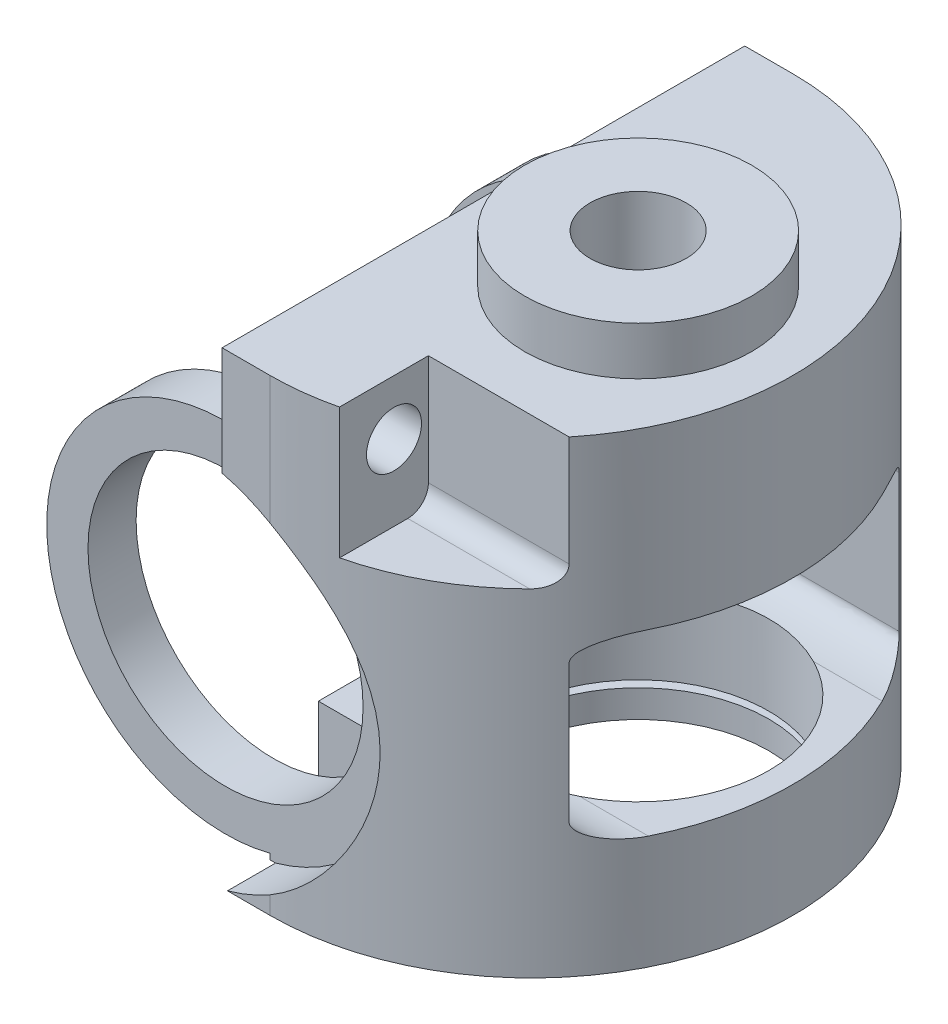
from build123d import *

# Parameters (mm, degrees)
SKETCH2_R               = 3.5
BOSS_EXTRUDE1_DEPTH     = 34
SKETCH19_R              = 8.25
SKETCH19_R_2            = 3.5
BOSS_EXTRUDE3_DEPTH     = 3.5
SKETCH7_R               = 13.5
CUT_EXTRUDE4_DEPTH      = 3.5
SKETCH25_R              = 13
BOSS_EXTRUDE4_DEPTH     = 3.5
SKETCH27_R              = 10
CUT_EXTRUDE13_DEPTH     = 3.5
LPATTERN3_COUNT         = 2
LPATTERN3_PITCH         = 34.5
LPATTERN4_COUNT         = 2
LPATTERN4_PITCH         = 27.5
SKETCH6_W               = 24
SKETCH6_H               = 13
CUT_EXTRUDE3_DEPTH      = 48.681233293
FILLET2_SIZE            = 3.5
FILLET2_SIZE_2          = 1.5
FILLET3_SIZE            = 1.5
FILLET3_SIZE_2          = 3.5
M2_TAPPED_HOLE1_D       = 1.6
M2_TAPPED_HOLE1_DEPTH   = 5.5
M2_TAPPED_HOLE1_TIP     = 0.480688495
SKETCH17_R              = 2
CUT_EXTRUDE5_DEPTH      = 8
CUT_EXTRUDE6_REACH      = 50.532
CUT_EXTRUDE6_END_RADIUS = 19
SKETCH20_R              = 9.75
CUT_EXTRUDE7_DEPTH      = 6.25
SKETCH21_R              = 8.5
CUT_EXTRUDE8_DEPTH      = 0.5
CUT_EXTRUDE9_DEPTH      = 1
CUT_EXTRUDE9_DEPTH_BACK = 5.75
SKETCH22_R              = 9.5
SKETCH23_R              = 10.5
CUT_EXTRUDE10_DEPTH     = 0.5
SKETCH24_R              = 9.5
CUT_EXTRUDE11_DEPTH     = 2


with BuildPart() as part:
    # Sketch2 → Boss-Extrude1 (new body)
    with BuildSketch(Plane(origin=(0, 0, 0), x_dir=(1, 0, 0), z_dir=(0, 1, 0))):
        with BuildLine():
            Line((-3.5, -19), (-3.5, 19))
            Line((-3.5, 19), (0, 19))
            ThreePointArc((0, 19), (19, 0), (0, -19))
            Line((0, -19), (-3.5, -19))
        make_face()
        with Locations(Location((7.75, 0, 0), (0, 0, 270))):
            Circle(SKETCH2_R, mode=Mode.SUBTRACT)
    extrude(amount=BOSS_EXTRUDE1_DEPTH)

    # Sketch19 → Boss-Extrude3 (add)
    with BuildSketch(Plane(origin=(0, 34, 0), x_dir=(1, 0, 0), z_dir=(0, 1, 0))):
        with Locations(Location((7.75, 0, 0), (0, 0, 270))):
            Circle(SKETCH19_R)
        with Locations(Location((7.75, 0, 0), (0, 0, 270))):
            Circle(SKETCH19_R_2, mode=Mode.SUBTRACT)
    extrude(amount=BOSS_EXTRUDE3_DEPTH)

    # Sketch7 → Cut-Extrude4 (cut)
    with BuildSketch(Plane(origin=(0, 0, 19), x_dir=(-1, 0, 0), z_dir=(0, 0, -1))):
        with Locations((6.75, 13)):
            Circle(SKETCH7_R)
    cut_extrude4 = extrude(amount=CUT_EXTRUDE4_DEPTH, mode=Mode.SUBTRACT)

    # Sketch25 → Boss-Extrude4 (add)
    with BuildSketch(Plane.XY.offset(15.5)):
        with Locations((-6.75, 13)):
            Circle(SKETCH25_R)
    boss_extrude4 = extrude(amount=-BOSS_EXTRUDE4_DEPTH)

    # Sketch27 → Cut-Extrude13 (cut)
    with BuildSketch(Plane.XY.offset(15.5)):
        with Locations((-6.75, 13)):
            Circle(SKETCH27_R)
    cut_extrude13 = extrude(amount=-CUT_EXTRUDE13_DEPTH, mode=Mode.SUBTRACT)

    # LPattern3: Cut-Extrude4 ×2
    with Locations(*[(0, 0, -i * LPATTERN3_PITCH) for i in range(1, LPATTERN3_COUNT)]):
        add(cut_extrude4, mode=Mode.SUBTRACT)

    # LPattern4: Boss-Extrude4, Cut-Extrude13 ×2
    with Locations(*[(0, 0, -i * LPATTERN4_PITCH) for i in range(1, LPATTERN4_COUNT)]):
        add(boss_extrude4)
        add(cut_extrude13, mode=Mode.SUBTRACT)

    # Sketch6 → Cut-Extrude3 (cut, through all)
    with BuildSketch(Plane(origin=(-3.5, 0, 0), x_dir=(0, 0, -1), z_dir=(1, 0, 0))):
        with Locations((0, 14.75)):
            Rectangle(SKETCH6_W, SKETCH6_H)
    extrude(amount=CUT_EXTRUDE3_DEPTH, mode=Mode.SUBTRACT)

    # Fillet2
    # an asymmetric fillet: 3.5, 1.5 mm, written as the material it adds along each edge
    with BuildSketch(Plane(origin=(-6.700142047, 8.25, -12), x_dir=(0, 0, 1), z_dir=(1, 0, 0))) as fillet2_piece_1_section:
        with BuildLine():
            Bezier((FILLET2_SIZE, 0), (0, 0), (0, -FILLET2_SIZE_2), weights=[1, 0.707106781, 1])
            Line((0, -FILLET2_SIZE_2), (0, 0))
            Line((0, 0), (FILLET2_SIZE, 0))
        make_face()
    fillet2_piece_1 = extrude(amount=30.181061909, mode=Mode.PRIVATE)
    fillet2_piece_1 = fillet2_piece_1 & Plane(origin=(0, 8.576273015, 0), x_dir=(0, 0, -1), z_dir=(0, -1, 0)) * Cylinder(19, 75, mode=Mode.PRIVATE)
    fillet2_piece_1 = fillet2_piece_1 - Plane(origin=(-6.75, 13, -11.191160215), x_dir=(1, 0, 0), z_dir=(0, 0, 1)) * Cylinder(10, 75, mode=Mode.PRIVATE)
    add(fillet2_piece_1)
    with BuildSketch(Plane(origin=(-9.848672722, 21.25, -12), x_dir=(0, 0, 1), z_dir=(1, 0, 0))) as fillet2_piece_2_section:
        with BuildLine():
            Bezier((FILLET2_SIZE, 0), (0, 0), (0, FILLET2_SIZE_2), weights=[1, 0.707106781, 1])
            Line((0, FILLET2_SIZE_2), (0, 0))
            Line((0, 0), (FILLET2_SIZE, 0))
        make_face()
    fillet2_piece_2 = extrude(amount=33.329592585, mode=Mode.PRIVATE)
    fillet2_piece_2 = fillet2_piece_2 & Plane(origin=(0, 20.925962544, 0), x_dir=(0, 0, -1), z_dir=(0, -1, 0)) * Cylinder(19, 81, mode=Mode.PRIVATE)
    fillet2_piece_2 = fillet2_piece_2 - Plane(origin=(-6.75, 13, -11.190685301), x_dir=(1, 0, 0), z_dir=(0, 0, 1)) * Cylinder(10, 81, mode=Mode.PRIVATE)
    add(fillet2_piece_2)

    # Fillet3
    # an asymmetric fillet: 3.5, 1.5 mm, written as the material it adds along each edge
    with BuildSketch(Plane(origin=(-6.700142047, 8.25, 12), x_dir=(0, 1, 0), z_dir=(1, 0, 0))) as fillet3_piece_1_section:
        with BuildLine():
            Bezier((FILLET3_SIZE, 0), (0, 0), (0, -FILLET3_SIZE_2), weights=[1, 0.707106781, 1])
            Line((0, -FILLET3_SIZE_2), (0, 0))
            Line((0, 0), (FILLET3_SIZE, 0))
        make_face()
    fillet3_piece_1 = extrude(amount=30.181061909, mode=Mode.PRIVATE)
    fillet3_piece_1 = fillet3_piece_1 & Plane(origin=(0, 8.576273496, 0), x_dir=(0, 0, -1), z_dir=(0, -1, 0)) * Cylinder(19, 75, mode=Mode.PRIVATE)
    fillet3_piece_1 = fillet3_piece_1 - Plane(origin=(-6.75, 13, 11.191157679), x_dir=(1, 0, 0), z_dir=(0, 0, 1)) * Cylinder(10, 75, mode=Mode.PRIVATE)
    add(fillet3_piece_1)
    with BuildSketch(Plane(origin=(-9.848672722, 21.25, 12), x_dir=(0, 0, -1), z_dir=(1, 0, 0))) as fillet3_piece_2_section:
        with BuildLine():
            Bezier((FILLET3_SIZE_2, 0), (0, 0), (0, -FILLET3_SIZE), weights=[1, 0.707106781, 1])
            Line((0, -FILLET3_SIZE), (0, 0))
            Line((0, 0), (FILLET3_SIZE_2, 0))
        make_face()
    fillet3_piece_2 = extrude(amount=33.329592585, mode=Mode.PRIVATE)
    fillet3_piece_2 = fillet3_piece_2 & Plane(origin=(0, 20.925963023, 0), x_dir=(0, 0, -1), z_dir=(0, -1, 0)) * Cylinder(19, 81, mode=Mode.PRIVATE)
    fillet3_piece_2 = fillet3_piece_2 - Plane(origin=(-6.75, 13, 11.19068509), x_dir=(1, 0, 0), z_dir=(0, 0, 1)) * Cylinder(10, 81, mode=Mode.PRIVATE)
    add(fillet3_piece_2)

    # M2 Tapped Hole1
    with Locations(Plane.ZY.offset(3.5)):
        with Locations((-11, 31.5)):
            Hole(M2_TAPPED_HOLE1_D / 2, depth=M2_TAPPED_HOLE1_DEPTH)
            with Locations((0, 0, -(M2_TAPPED_HOLE1_DEPTH + M2_TAPPED_HOLE1_TIP / 2))):  # 118° drill point
                Cone(0, M2_TAPPED_HOLE1_D / 2, M2_TAPPED_HOLE1_TIP, mode=Mode.SUBTRACT)

    # Sketch17 → Cut-Extrude5 (cut)
    with BuildSketch(Plane.ZY.offset(3.5)):
        with Locations((14.5, 30)):
            Circle(SKETCH17_R)
    extrude(amount=-CUT_EXTRUDE5_DEPTH, mode=Mode.SUBTRACT)

    # Cut-Extrude6: up to this cylinder (the profile starts inside it)
    cut_extrude6_end = Plane(origin=(0, 29.282291, 0), z_dir=(0, -1, 0)) * Cylinder(CUT_EXTRUDE6_END_RADIUS, 140.064, mode=Mode.PRIVATE)
    # Sketch18 → Cut-Extrude6 (cut, up to the surface)
    with BuildSketch(Plane.ZY.offset(-4.5), mode=Mode.PRIVATE) as cut_extrude6_sk1:
        with BuildLine():
            Line((12, 26), (12, 34))
            Line((12, 34), (19, 34))
            Line((19, 34), (19, 24.5))
            Line((19, 24.5), (13.5, 24.5))
            ThreePointArc((13.5, 24.5), (12.439339828, 24.939339828), (12, 26))
        make_face()
    cut_extrude6_tool1 = extrude(cut_extrude6_sk1.sketch, amount=-CUT_EXTRUDE6_REACH, mode=Mode.PRIVATE) & cut_extrude6_end
    add(cut_extrude6_tool1.solids().sort_by_distance((4.5, 29.282291, 15.523149))[0], mode=Mode.SUBTRACT)

    # Sketch20 → Cut-Extrude7 (cut)
    with BuildSketch(Plane.XZ.offset(-21.25)):
        with Locations(Location((7.75, 0, 0), (0, 0, 270))):
            Circle(SKETCH20_R)
    extrude(amount=-CUT_EXTRUDE7_DEPTH, mode=Mode.SUBTRACT)

    # Sketch21 → Cut-Extrude8 (cut)
    with BuildSketch(Plane.XZ.offset(-27.5)):
        with Locations(Location((7.75, 0, 0), (0, 0, 270))):
            Circle(SKETCH21_R)
    extrude(amount=-CUT_EXTRUDE8_DEPTH, mode=Mode.SUBTRACT)

    # Sketch22 → Cut-Extrude9 (cut, two sides: drawn at the far end of the back side and taken through both)
    with BuildSketch(Plane(origin=(0, 8.25, 0), x_dir=(1, 0, 0), z_dir=(0, 1, 0)).offset(-CUT_EXTRUDE9_DEPTH_BACK)):
        with Locations(Location((7.75, 0, 0), (0, 0, 116.525351846))):
            Circle(SKETCH22_R)
    extrude(amount=CUT_EXTRUDE9_DEPTH + CUT_EXTRUDE9_DEPTH_BACK, mode=Mode.SUBTRACT)

    # Sketch23 → Cut-Extrude10 (cut)
    with BuildSketch(Plane(origin=(0, 2.5, 0), x_dir=(1, 0, 0), z_dir=(0, 1, 0))):
        with Locations(Location((7.75, 0, 0), (0, 0, 270))):
            Circle(SKETCH23_R)
    extrude(amount=-CUT_EXTRUDE10_DEPTH, mode=Mode.SUBTRACT)

    # Sketch24 → Cut-Extrude11 (cut)
    with BuildSketch(Plane(origin=(0, 2, 0), x_dir=(1, 0, 0), z_dir=(0, 1, 0))):
        with Locations(Location((7.75, 0, 0), (0, 0, 116.525351846))):
            Circle(SKETCH24_R)
    extrude(amount=-CUT_EXTRUDE11_DEPTH, mode=Mode.SUBTRACT)


solid = part.part
